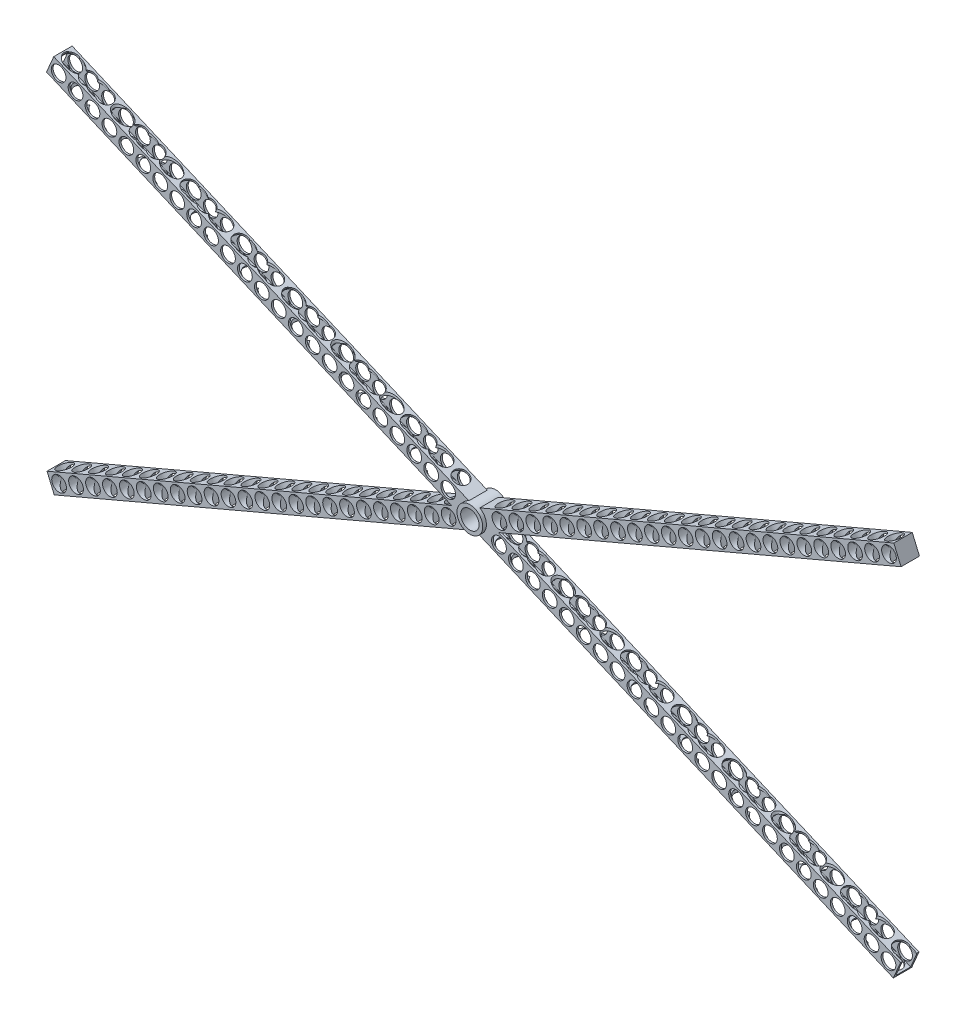
from build123d import *

# Parameters (mm, degrees)
SKIZZE1_R                        = 35
SKIZZE1_R_2                      = 25
AUFSATZ_LINEAR_AUSTRAGEN1_DEPTH  = 70
SKIZZE4_W                        = 50
SKIZZE4_H                        = 50
AUFSATZ_LINEAR_AUSTRAGEN3_DEPTH  = 1250
SKIZZE5_W                        = 40
SKIZZE5_H                        = 40
SCHNITT_LINEAR_AUSTRAGEN2_DEPTH  = 1250
SKIZZE7_R                        = 20
SCHNITT_LINEAR_AUSTRAGEN4_DEPTH  = 1270.580645038
LINEARES_MUSTER2_COUNT           = 24
LINEARES_MUSTER2_PITCH           = 50
SKIZZE9_R                        = 20
SCHNITT_LINEAR_AUSTRAGEN6_DEPTH  = 1271.679028403
LINEARES_MUSTER3_COUNT           = 24
LINEARES_MUSTER3_PITCH           = 50
SPIEGELN7_COPY_1_SKETCH_R        = 20
SPIEGELN7_COPY_1_DEPTH           = 1270.580645038
SPIEGELN7_COPY_2_SKETCH_R        = 20
SPIEGELN7_COPY_2_DEPTH           = 1270.580645038
SPIEGELN7_COPY_3_SKETCH_R        = 20
SPIEGELN7_COPY_3_DEPTH           = 1270.580645038
SPIEGELN7_COPY_4_SKETCH_R        = 20
SPIEGELN7_COPY_4_DEPTH           = 1270.580645038
SPIEGELN7_COPY_5_SKETCH_R        = 20
SPIEGELN7_COPY_5_DEPTH           = 1270.580645038
SPIEGELN7_COPY_6_SKETCH_R        = 20
SPIEGELN7_COPY_6_DEPTH           = 1270.580645038
SPIEGELN7_COPY_7_SKETCH_R        = 20
SPIEGELN7_COPY_7_DEPTH           = 1270.580645038
SPIEGELN7_COPY_8_SKETCH_R        = 20
SPIEGELN7_COPY_8_DEPTH           = 1270.580645038
SPIEGELN7_COPY_9_SKETCH_R        = 20
SPIEGELN7_COPY_9_DEPTH           = 1270.580645038
SPIEGELN7_COPY_10_SKETCH_R       = 20
SPIEGELN7_COPY_10_DEPTH          = 1270.580645038
SPIEGELN7_COPY_11_SKETCH_R       = 20
SPIEGELN7_COPY_11_DEPTH          = 1270.580645038
SPIEGELN7_COPY_12_SKETCH_R       = 20
SPIEGELN7_COPY_12_DEPTH          = 1270.580645038
SPIEGELN7_COPY_13_SKETCH_R       = 20
SPIEGELN7_COPY_13_DEPTH          = 1270.580645038
SPIEGELN7_COPY_14_SKETCH_R       = 20
SPIEGELN7_COPY_14_DEPTH          = 1270.580645038
SPIEGELN7_COPY_15_SKETCH_R       = 20
SPIEGELN7_COPY_15_DEPTH          = 1270.580645038
SPIEGELN7_COPY_16_SKETCH_R       = 20
SPIEGELN7_COPY_16_DEPTH          = 1270.580645038
SPIEGELN7_COPY_17_SKETCH_R       = 20
SPIEGELN7_COPY_17_DEPTH          = 1270.580645038
SPIEGELN7_COPY_18_SKETCH_R       = 20
SPIEGELN7_COPY_18_DEPTH          = 1270.580645038
SPIEGELN7_COPY_19_SKETCH_R       = 20
SPIEGELN7_COPY_19_DEPTH          = 1270.580645038
SPIEGELN7_COPY_20_SKETCH_R       = 20
SPIEGELN7_COPY_20_DEPTH          = 1270.580645038
SPIEGELN7_COPY_21_SKETCH_R       = 20
SPIEGELN7_COPY_21_DEPTH          = 1270.580645038
SPIEGELN7_COPY_22_SKETCH_R       = 20
SPIEGELN7_COPY_22_DEPTH          = 1270.580645038
SPIEGELN7_COPY_23_SKETCH_R       = 20
SPIEGELN7_COPY_23_DEPTH          = 1270.580645038
SPIEGELN7_COPY_24_SKETCH_R       = 20
SPIEGELN7_COPY_24_DEPTH          = 1271.679028403
SPIEGELN7_COPY_25_SKETCH_R       = 20
SPIEGELN7_COPY_25_DEPTH          = 1271.679028403
SPIEGELN7_COPY_26_SKETCH_R       = 20
SPIEGELN7_COPY_26_DEPTH          = 1271.679028403
SPIEGELN7_COPY_27_SKETCH_R       = 20
SPIEGELN7_COPY_27_DEPTH          = 1271.679028403
SPIEGELN7_COPY_28_SKETCH_R       = 20
SPIEGELN7_COPY_28_DEPTH          = 1271.679028403
SPIEGELN7_COPY_29_SKETCH_R       = 20
SPIEGELN7_COPY_29_DEPTH          = 1271.679028403
SPIEGELN7_COPY_30_SKETCH_R       = 20
SPIEGELN7_COPY_30_DEPTH          = 1271.679028403
SPIEGELN7_COPY_31_SKETCH_R       = 20
SPIEGELN7_COPY_31_DEPTH          = 1271.679028403
SPIEGELN7_COPY_32_SKETCH_R       = 20
SPIEGELN7_COPY_32_DEPTH          = 1271.679028403
SPIEGELN7_COPY_33_SKETCH_R       = 20
SPIEGELN7_COPY_33_DEPTH          = 1271.679028403
SPIEGELN7_COPY_34_SKETCH_R       = 20
SPIEGELN7_COPY_34_DEPTH          = 1271.679028403
SPIEGELN7_COPY_35_SKETCH_R       = 20
SPIEGELN7_COPY_35_DEPTH          = 1271.679028403
SPIEGELN7_COPY_36_SKETCH_R       = 20
SPIEGELN7_COPY_36_DEPTH          = 1271.679028403
SPIEGELN7_COPY_37_SKETCH_R       = 20
SPIEGELN7_COPY_37_DEPTH          = 1271.679028403
SPIEGELN7_COPY_38_SKETCH_R       = 20
SPIEGELN7_COPY_38_DEPTH          = 1271.679028403
SPIEGELN7_COPY_39_SKETCH_R       = 20
SPIEGELN7_COPY_39_DEPTH          = 1271.679028403
SPIEGELN7_COPY_40_SKETCH_R       = 20
SPIEGELN7_COPY_40_DEPTH          = 1271.679028403
SPIEGELN7_COPY_41_SKETCH_R       = 20
SPIEGELN7_COPY_41_DEPTH          = 1271.679028403
SPIEGELN7_COPY_42_SKETCH_R       = 20
SPIEGELN7_COPY_42_DEPTH          = 1271.679028403
SPIEGELN7_COPY_43_SKETCH_R       = 20
SPIEGELN7_COPY_43_DEPTH          = 1271.679028403
SPIEGELN7_COPY_44_SKETCH_R       = 20
SPIEGELN7_COPY_44_DEPTH          = 1271.679028403
SPIEGELN7_COPY_45_SKETCH_R       = 20
SPIEGELN7_COPY_45_DEPTH          = 1271.679028403
SPIEGELN7_COPY_46_SKETCH_R       = 20
SPIEGELN7_COPY_46_DEPTH          = 1271.679028403
SKIZZE11_W                       = 50
SKIZZE11_H                       = 50
AUFSATZ_LINEAR_AUSTRAGEN4_DEPTH  = 1250
SKIZZE12_R                       = 20
SCHNITT_LINEAR_AUSTRAGEN8_DEPTH  = 1271.824523178
LINEARES_MUSTER4_COUNT           = 24
LINEARES_MUSTER4_PITCH           = 50
SKIZZE13_R                       = 20
SCHNITT_LINEAR_AUSTRAGEN9_DEPTH  = 1288.130598022
LINEARES_MUSTER5_COUNT           = 24
LINEARES_MUSTER5_PITCH           = 50
SPIEGELN8_COPY_1_SKETCH_R        = 20
SPIEGELN8_COPY_1_DEPTH           = 1271.824523178
SPIEGELN8_COPY_2_SKETCH_R        = 20
SPIEGELN8_COPY_2_DEPTH           = 1271.824523178
SPIEGELN8_COPY_3_SKETCH_R        = 20
SPIEGELN8_COPY_3_DEPTH           = 1271.824523178
SPIEGELN8_COPY_4_SKETCH_R        = 20
SPIEGELN8_COPY_4_DEPTH           = 1271.824523178
SPIEGELN8_COPY_5_SKETCH_R        = 20
SPIEGELN8_COPY_5_DEPTH           = 1271.824523178
SPIEGELN8_COPY_6_SKETCH_R        = 20
SPIEGELN8_COPY_6_DEPTH           = 1271.824523178
SPIEGELN8_COPY_7_SKETCH_R        = 20
SPIEGELN8_COPY_7_DEPTH           = 1271.824523178
SPIEGELN8_COPY_8_SKETCH_R        = 20
SPIEGELN8_COPY_8_DEPTH           = 1271.824523178
SPIEGELN8_COPY_9_SKETCH_R        = 20
SPIEGELN8_COPY_9_DEPTH           = 1271.824523178
SPIEGELN8_COPY_10_SKETCH_R       = 20
SPIEGELN8_COPY_10_DEPTH          = 1271.824523178
SPIEGELN8_COPY_11_SKETCH_R       = 20
SPIEGELN8_COPY_11_DEPTH          = 1271.824523178
SPIEGELN8_COPY_12_SKETCH_R       = 20
SPIEGELN8_COPY_12_DEPTH          = 1271.824523178
SPIEGELN8_COPY_13_SKETCH_R       = 20
SPIEGELN8_COPY_13_DEPTH          = 1271.824523178
SPIEGELN8_COPY_14_SKETCH_R       = 20
SPIEGELN8_COPY_14_DEPTH          = 1271.824523178
SPIEGELN8_COPY_15_SKETCH_R       = 20
SPIEGELN8_COPY_15_DEPTH          = 1271.824523178
SPIEGELN8_COPY_16_SKETCH_R       = 20
SPIEGELN8_COPY_16_DEPTH          = 1271.824523178
SPIEGELN8_COPY_17_SKETCH_R       = 20
SPIEGELN8_COPY_17_DEPTH          = 1271.824523178
SPIEGELN8_COPY_18_SKETCH_R       = 20
SPIEGELN8_COPY_18_DEPTH          = 1271.824523178
SPIEGELN8_COPY_19_SKETCH_R       = 20
SPIEGELN8_COPY_19_DEPTH          = 1271.824523178
SPIEGELN8_COPY_20_SKETCH_R       = 20
SPIEGELN8_COPY_20_DEPTH          = 1271.824523178
SPIEGELN8_COPY_21_SKETCH_R       = 20
SPIEGELN8_COPY_21_DEPTH          = 1271.824523178
SPIEGELN8_COPY_22_SKETCH_R       = 20
SPIEGELN8_COPY_22_DEPTH          = 1271.824523178
SPIEGELN8_COPY_23_SKETCH_R       = 20
SPIEGELN8_COPY_23_DEPTH          = 1271.824523178
SPIEGELN8_COPY_24_SKETCH_R       = 20
SPIEGELN8_COPY_24_DEPTH          = 1288.130598022
SPIEGELN8_COPY_25_SKETCH_R       = 20
SPIEGELN8_COPY_25_DEPTH          = 1288.130598022
SPIEGELN8_COPY_26_SKETCH_R       = 20
SPIEGELN8_COPY_26_DEPTH          = 1288.130598022
SPIEGELN8_COPY_27_SKETCH_R       = 20
SPIEGELN8_COPY_27_DEPTH          = 1288.130598022
SPIEGELN8_COPY_28_SKETCH_R       = 20
SPIEGELN8_COPY_28_DEPTH          = 1288.130598022
SPIEGELN8_COPY_29_SKETCH_R       = 20
SPIEGELN8_COPY_29_DEPTH          = 1288.130598022
SPIEGELN8_COPY_30_SKETCH_R       = 20
SPIEGELN8_COPY_30_DEPTH          = 1288.130598022
SPIEGELN8_COPY_31_SKETCH_R       = 20
SPIEGELN8_COPY_31_DEPTH          = 1288.130598022
SPIEGELN8_COPY_32_SKETCH_R       = 20
SPIEGELN8_COPY_32_DEPTH          = 1288.130598022
SPIEGELN8_COPY_33_SKETCH_R       = 20
SPIEGELN8_COPY_33_DEPTH          = 1288.130598022
SPIEGELN8_COPY_34_SKETCH_R       = 20
SPIEGELN8_COPY_34_DEPTH          = 1288.130598022
SPIEGELN8_COPY_35_SKETCH_R       = 20
SPIEGELN8_COPY_35_DEPTH          = 1288.130598022
SPIEGELN8_COPY_36_SKETCH_R       = 20
SPIEGELN8_COPY_36_DEPTH          = 1288.130598022
SPIEGELN8_COPY_37_SKETCH_R       = 20
SPIEGELN8_COPY_37_DEPTH          = 1288.130598022
SPIEGELN8_COPY_38_SKETCH_R       = 20
SPIEGELN8_COPY_38_DEPTH          = 1288.130598022
SPIEGELN8_COPY_39_SKETCH_R       = 20
SPIEGELN8_COPY_39_DEPTH          = 1288.130598022
SPIEGELN8_COPY_40_SKETCH_R       = 20
SPIEGELN8_COPY_40_DEPTH          = 1288.130598022
SPIEGELN8_COPY_41_SKETCH_R       = 20
SPIEGELN8_COPY_41_DEPTH          = 1288.130598022
SPIEGELN8_COPY_42_SKETCH_R       = 20
SPIEGELN8_COPY_42_DEPTH          = 1288.130598022
SPIEGELN8_COPY_43_SKETCH_R       = 20
SPIEGELN8_COPY_43_DEPTH          = 1288.130598022
SPIEGELN8_COPY_44_SKETCH_R       = 20
SPIEGELN8_COPY_44_DEPTH          = 1288.130598022
SPIEGELN8_COPY_45_SKETCH_R       = 20
SPIEGELN8_COPY_45_DEPTH          = 1288.130598022
SPIEGELN8_COPY_46_SKETCH_R       = 20
SPIEGELN8_COPY_46_DEPTH          = 1288.130598022
SKIZZE14_R                       = 25
SCHNITT_LINEAR_AUSTRAGEN10_DEPTH = 1273.628530597


with BuildPart() as part:
    # Skizze1 → Aufsatz-Linear austragen1 (new body)
    with BuildSketch(Plane.XY):
        Circle(SKIZZE1_R)
        Circle(SKIZZE1_R_2, mode=Mode.SUBTRACT)
    extrude(amount=AUFSATZ_LINEAR_AUSTRAGEN1_DEPTH)

    # Skizze4 → Aufsatz-Linear austragen3 (add)
    with BuildSketch(Plane(origin=(0, 0, 0), x_dir=(0, 0, -1), z_dir=(-0.919821497321739, 0.39233711660355824, 0))):
        with Locations((-35, 0)):
            Rectangle(SKIZZE4_W, SKIZZE4_H)
    aufsatz_linear_austragen3 = extrude(amount=AUFSATZ_LINEAR_AUSTRAGEN3_DEPTH)

    # Skizze5 → Schnitt-Linear austragen2 (cut)
    with BuildSketch(Plane(origin=(-1149.776871652, 490.421395754, 0), x_dir=(0, 0, 1), z_dir=(-0.919821497321739, 0.3923371166035583, 0))):
        with Locations((35, 0)):
            Rectangle(SKIZZE5_W, SKIZZE5_H)
    schnitt_linear_austragen2 = extrude(amount=-SCHNITT_LINEAR_AUSTRAGEN2_DEPTH, mode=Mode.SUBTRACT)

    # Skizze7 → Schnitt-Linear austragen4 (cut, symmetric)
    with BuildSketch(Plane.XY.offset(60)):
        with Locations(Location((-1126.781334219, 480.612967839, 0), (0, 0, 66.9))):
            Circle(SKIZZE7_R)
    schnitt_linear_austragen4 = extrude(amount=SCHNITT_LINEAR_AUSTRAGEN4_DEPTH, both=True, mode=Mode.SUBTRACT)

    # Lineares Muster2: Schnitt-Linear austragen4 ×24
    with Locations(*[Vector(0.9198214973217392, -0.39233711660355797, 0) * (i * LINEARES_MUSTER2_PITCH) for i in range(1, LINEARES_MUSTER2_COUNT)]):
        add(schnitt_linear_austragen4, mode=Mode.SUBTRACT)

    # Skizze9 → Schnitt-Linear austragen6 (cut, symmetric)
    with BuildSketch(Plane(origin=(-9.808427915, -22.995537433, 0), x_dir=(0.919821497321739, -0.39233711660355847, 0), z_dir=(-0.3923371166035584, -0.9198214973217389, 0))):
        with Locations((-1225, 35)):
            Circle(SKIZZE9_R)
    schnitt_linear_austragen6 = extrude(amount=SCHNITT_LINEAR_AUSTRAGEN6_DEPTH, both=True, mode=Mode.SUBTRACT)

    # Lineares Muster3: Schnitt-Linear austragen6 ×24
    with Locations(*[Vector(0.919821497321739, -0.39233711660355847, 0) * (i * LINEARES_MUSTER3_PITCH) for i in range(1, LINEARES_MUSTER3_COUNT)]):
        add(schnitt_linear_austragen6, mode=Mode.SUBTRACT)

    # Spiegeln7: Aufsatz-Linear austragen3, Schnitt-Linear austragen2, Schnitt-Linear austragen4, Schnitt-Linear austragen6 across plane
    add(aufsatz_linear_austragen3.mirror(Plane(origin=(0, 0, 0), x_dir=(0, 0, 1), z_dir=(-0.919821497321739, 0.39233711660355824, 0))))
    add(schnitt_linear_austragen2.mirror(Plane(origin=(0, 0, 0), x_dir=(0, 0, 1), z_dir=(-0.919821497321739, 0.39233711660355824, 0))), mode=Mode.SUBTRACT)
    add(schnitt_linear_austragen4.mirror(Plane(origin=(0, 0, 0), x_dir=(0, 0, 1), z_dir=(-0.919821497321739, 0.39233711660355824, 0))), mode=Mode.SUBTRACT)
    add(schnitt_linear_austragen6.mirror(Plane(origin=(0, 0, 0), x_dir=(0, 0, 1), z_dir=(-0.919821497321739, 0.39233711660355824, 0))), mode=Mode.SUBTRACT)

    # Spiegeln7 copy 1 sketch → Spiegeln7 copy 1 (cut, symmetric)
    with BuildSketch(Plane(origin=(-45.991074866, 19.61685583, 60), x_dir=(-0.6921431738704118, 0.7217602280983573, 0), z_dir=(0, 0, 1))):
        with Locations((-1126.781334219, -480.612967839)):
            Circle(SPIEGELN7_COPY_1_SKETCH_R)
    extrude(amount=SPIEGELN7_COPY_1_DEPTH, both=True, mode=Mode.SUBTRACT)

    # Spiegeln7 copy 2 sketch → Spiegeln7 copy 2 (cut, symmetric)
    with BuildSketch(Plane(origin=(-91.982149732, 39.23371166, 60), x_dir=(-0.6921431738704118, 0.7217602280983573, 0), z_dir=(0, 0, 1))):
        with Locations((-1126.781334219, -480.612967839)):
            Circle(SPIEGELN7_COPY_2_SKETCH_R)
    extrude(amount=SPIEGELN7_COPY_2_DEPTH, both=True, mode=Mode.SUBTRACT)

    # Spiegeln7 copy 3 sketch → Spiegeln7 copy 3 (cut, symmetric)
    with BuildSketch(Plane(origin=(-137.973224598, 58.850567491, 60), x_dir=(-0.6921431738704118, 0.7217602280983573, 0), z_dir=(0, 0, 1))):
        with Locations((-1126.781334219, -480.612967839)):
            Circle(SPIEGELN7_COPY_3_SKETCH_R)
    extrude(amount=SPIEGELN7_COPY_3_DEPTH, both=True, mode=Mode.SUBTRACT)

    # Spiegeln7 copy 4 sketch → Spiegeln7 copy 4 (cut, symmetric)
    with BuildSketch(Plane(origin=(-183.964299464, 78.467423321, 60), x_dir=(-0.6921431738704118, 0.7217602280983573, 0), z_dir=(0, 0, 1))):
        with Locations((-1126.781334219, -480.612967839)):
            Circle(SPIEGELN7_COPY_4_SKETCH_R)
    extrude(amount=SPIEGELN7_COPY_4_DEPTH, both=True, mode=Mode.SUBTRACT)

    # Spiegeln7 copy 5 sketch → Spiegeln7 copy 5 (cut, symmetric)
    with BuildSketch(Plane(origin=(-229.95537433, 98.084279151, 60), x_dir=(-0.6921431738704118, 0.7217602280983573, 0), z_dir=(0, 0, 1))):
        with Locations((-1126.781334219, -480.612967839)):
            Circle(SPIEGELN7_COPY_5_SKETCH_R)
    extrude(amount=SPIEGELN7_COPY_5_DEPTH, both=True, mode=Mode.SUBTRACT)

    # Spiegeln7 copy 6 sketch → Spiegeln7 copy 6 (cut, symmetric)
    with BuildSketch(Plane(origin=(-275.946449197, 117.701134981, 60), x_dir=(-0.6921431738704118, 0.7217602280983573, 0), z_dir=(0, 0, 1))):
        with Locations((-1126.781334219, -480.612967839)):
            Circle(SPIEGELN7_COPY_6_SKETCH_R)
    extrude(amount=SPIEGELN7_COPY_6_DEPTH, both=True, mode=Mode.SUBTRACT)

    # Spiegeln7 copy 7 sketch → Spiegeln7 copy 7 (cut, symmetric)
    with BuildSketch(Plane(origin=(-321.937524063, 137.317990811, 60), x_dir=(-0.6921431738704118, 0.7217602280983573, 0), z_dir=(0, 0, 1))):
        with Locations((-1126.781334219, -480.612967839)):
            Circle(SPIEGELN7_COPY_7_SKETCH_R)
    extrude(amount=SPIEGELN7_COPY_7_DEPTH, both=True, mode=Mode.SUBTRACT)

    # Spiegeln7 copy 8 sketch → Spiegeln7 copy 8 (cut, symmetric)
    with BuildSketch(Plane(origin=(-367.928598929, 156.934846641, 60), x_dir=(-0.6921431738704118, 0.7217602280983573, 0), z_dir=(0, 0, 1))):
        with Locations((-1126.781334219, -480.612967839)):
            Circle(SPIEGELN7_COPY_8_SKETCH_R)
    extrude(amount=SPIEGELN7_COPY_8_DEPTH, both=True, mode=Mode.SUBTRACT)

    # Spiegeln7 copy 9 sketch → Spiegeln7 copy 9 (cut, symmetric)
    with BuildSketch(Plane(origin=(-413.919673795, 176.551702472, 60), x_dir=(-0.6921431738704118, 0.7217602280983573, 0), z_dir=(0, 0, 1))):
        with Locations((-1126.781334219, -480.612967839)):
            Circle(SPIEGELN7_COPY_9_SKETCH_R)
    extrude(amount=SPIEGELN7_COPY_9_DEPTH, both=True, mode=Mode.SUBTRACT)

    # Spiegeln7 copy 10 sketch → Spiegeln7 copy 10 (cut, symmetric)
    with BuildSketch(Plane(origin=(-459.910748661, 196.168558302, 60), x_dir=(-0.6921431738704118, 0.7217602280983573, 0), z_dir=(0, 0, 1))):
        with Locations((-1126.781334219, -480.612967839)):
            Circle(SPIEGELN7_COPY_10_SKETCH_R)
    extrude(amount=SPIEGELN7_COPY_10_DEPTH, both=True, mode=Mode.SUBTRACT)

    # Spiegeln7 copy 11 sketch → Spiegeln7 copy 11 (cut, symmetric)
    with BuildSketch(Plane(origin=(-505.901823527, 215.785414132, 60), x_dir=(-0.6921431738704118, 0.7217602280983573, 0), z_dir=(0, 0, 1))):
        with Locations((-1126.781334219, -480.612967839)):
            Circle(SPIEGELN7_COPY_11_SKETCH_R)
    extrude(amount=SPIEGELN7_COPY_11_DEPTH, both=True, mode=Mode.SUBTRACT)

    # Spiegeln7 copy 12 sketch → Spiegeln7 copy 12 (cut, symmetric)
    with BuildSketch(Plane(origin=(-551.892898393, 235.402269962, 60), x_dir=(-0.6921431738704118, 0.7217602280983573, 0), z_dir=(0, 0, 1))):
        with Locations((-1126.781334219, -480.612967839)):
            Circle(SPIEGELN7_COPY_12_SKETCH_R)
    extrude(amount=SPIEGELN7_COPY_12_DEPTH, both=True, mode=Mode.SUBTRACT)

    # Spiegeln7 copy 13 sketch → Spiegeln7 copy 13 (cut, symmetric)
    with BuildSketch(Plane(origin=(-597.883973259, 255.019125792, 60), x_dir=(-0.6921431738704118, 0.7217602280983573, 0), z_dir=(0, 0, 1))):
        with Locations((-1126.781334219, -480.612967839)):
            Circle(SPIEGELN7_COPY_13_SKETCH_R)
    extrude(amount=SPIEGELN7_COPY_13_DEPTH, both=True, mode=Mode.SUBTRACT)

    # Spiegeln7 copy 14 sketch → Spiegeln7 copy 14 (cut, symmetric)
    with BuildSketch(Plane(origin=(-643.875048125, 274.635981622, 60), x_dir=(-0.6921431738704118, 0.7217602280983573, 0), z_dir=(0, 0, 1))):
        with Locations((-1126.781334219, -480.612967839)):
            Circle(SPIEGELN7_COPY_14_SKETCH_R)
    extrude(amount=SPIEGELN7_COPY_14_DEPTH, both=True, mode=Mode.SUBTRACT)

    # Spiegeln7 copy 15 sketch → Spiegeln7 copy 15 (cut, symmetric)
    with BuildSketch(Plane(origin=(-689.866122991, 294.252837453, 60), x_dir=(-0.6921431738704118, 0.7217602280983573, 0), z_dir=(0, 0, 1))):
        with Locations((-1126.781334219, -480.612967839)):
            Circle(SPIEGELN7_COPY_15_SKETCH_R)
    extrude(amount=SPIEGELN7_COPY_15_DEPTH, both=True, mode=Mode.SUBTRACT)

    # Spiegeln7 copy 16 sketch → Spiegeln7 copy 16 (cut, symmetric)
    with BuildSketch(Plane(origin=(-735.857197857, 313.869693283, 60), x_dir=(-0.6921431738704118, 0.7217602280983573, 0), z_dir=(0, 0, 1))):
        with Locations((-1126.781334219, -480.612967839)):
            Circle(SPIEGELN7_COPY_16_SKETCH_R)
    extrude(amount=SPIEGELN7_COPY_16_DEPTH, both=True, mode=Mode.SUBTRACT)

    # Spiegeln7 copy 17 sketch → Spiegeln7 copy 17 (cut, symmetric)
    with BuildSketch(Plane(origin=(-781.848272723, 333.486549113, 60), x_dir=(-0.6921431738704118, 0.7217602280983573, 0), z_dir=(0, 0, 1))):
        with Locations((-1126.781334219, -480.612967839)):
            Circle(SPIEGELN7_COPY_17_SKETCH_R)
    extrude(amount=SPIEGELN7_COPY_17_DEPTH, both=True, mode=Mode.SUBTRACT)

    # Spiegeln7 copy 18 sketch → Spiegeln7 copy 18 (cut, symmetric)
    with BuildSketch(Plane(origin=(-827.83934759, 353.103404943, 60), x_dir=(-0.6921431738704118, 0.7217602280983573, 0), z_dir=(0, 0, 1))):
        with Locations((-1126.781334219, -480.612967839)):
            Circle(SPIEGELN7_COPY_18_SKETCH_R)
    extrude(amount=SPIEGELN7_COPY_18_DEPTH, both=True, mode=Mode.SUBTRACT)

    # Spiegeln7 copy 19 sketch → Spiegeln7 copy 19 (cut, symmetric)
    with BuildSketch(Plane(origin=(-873.830422456, 372.720260773, 60), x_dir=(-0.6921431738704118, 0.7217602280983573, 0), z_dir=(0, 0, 1))):
        with Locations((-1126.781334219, -480.612967839)):
            Circle(SPIEGELN7_COPY_19_SKETCH_R)
    extrude(amount=SPIEGELN7_COPY_19_DEPTH, both=True, mode=Mode.SUBTRACT)

    # Spiegeln7 copy 20 sketch → Spiegeln7 copy 20 (cut, symmetric)
    with BuildSketch(Plane(origin=(-919.821497322, 392.337116604, 60), x_dir=(-0.6921431738704118, 0.7217602280983573, 0), z_dir=(0, 0, 1))):
        with Locations((-1126.781334219, -480.612967839)):
            Circle(SPIEGELN7_COPY_20_SKETCH_R)
    extrude(amount=SPIEGELN7_COPY_20_DEPTH, both=True, mode=Mode.SUBTRACT)

    # Spiegeln7 copy 21 sketch → Spiegeln7 copy 21 (cut, symmetric)
    with BuildSketch(Plane(origin=(-965.812572188, 411.953972434, 60), x_dir=(-0.6921431738704118, 0.7217602280983573, 0), z_dir=(0, 0, 1))):
        with Locations((-1126.781334219, -480.612967839)):
            Circle(SPIEGELN7_COPY_21_SKETCH_R)
    extrude(amount=SPIEGELN7_COPY_21_DEPTH, both=True, mode=Mode.SUBTRACT)

    # Spiegeln7 copy 22 sketch → Spiegeln7 copy 22 (cut, symmetric)
    with BuildSketch(Plane(origin=(-1011.803647054, 431.570828264, 60), x_dir=(-0.6921431738704118, 0.7217602280983573, 0), z_dir=(0, 0, 1))):
        with Locations((-1126.781334219, -480.612967839)):
            Circle(SPIEGELN7_COPY_22_SKETCH_R)
    extrude(amount=SPIEGELN7_COPY_22_DEPTH, both=True, mode=Mode.SUBTRACT)

    # Spiegeln7 copy 23 sketch → Spiegeln7 copy 23 (cut, symmetric)
    with BuildSketch(Plane(origin=(-1057.79472192, 451.187684094, 60), x_dir=(-0.6921431738704118, 0.7217602280983573, 0), z_dir=(0, 0, 1))):
        with Locations((-1126.781334219, -480.612967839)):
            Circle(SPIEGELN7_COPY_23_SKETCH_R)
    extrude(amount=SPIEGELN7_COPY_23_DEPTH, both=True, mode=Mode.SUBTRACT)

    # Spiegeln7 copy 24 sketch → Spiegeln7 copy 24 (cut, symmetric)
    with BuildSketch(Plane(origin=(-55.799502781, -3.378681603, 0), x_dir=(-0.9198214973217391, 0.3923371166035581, 0), z_dir=(-0.392337116603558, -0.9198214973217391, 0))):
        with Locations((-1225, -35)):
            Circle(SPIEGELN7_COPY_24_SKETCH_R)
    extrude(amount=SPIEGELN7_COPY_24_DEPTH, both=True, mode=Mode.SUBTRACT)

    # Spiegeln7 copy 25 sketch → Spiegeln7 copy 25 (cut, symmetric)
    with BuildSketch(Plane(origin=(-101.790577647, 16.238174227, 0), x_dir=(-0.9198214973217391, 0.3923371166035581, 0), z_dir=(-0.392337116603558, -0.9198214973217391, 0))):
        with Locations((-1225, -35)):
            Circle(SPIEGELN7_COPY_25_SKETCH_R)
    extrude(amount=SPIEGELN7_COPY_25_DEPTH, both=True, mode=Mode.SUBTRACT)

    # Spiegeln7 copy 26 sketch → Spiegeln7 copy 26 (cut, symmetric)
    with BuildSketch(Plane(origin=(-147.781652513, 35.855030057, 0), x_dir=(-0.9198214973217391, 0.3923371166035581, 0), z_dir=(-0.392337116603558, -0.9198214973217391, 0))):
        with Locations((-1225, -35)):
            Circle(SPIEGELN7_COPY_26_SKETCH_R)
    extrude(amount=SPIEGELN7_COPY_26_DEPTH, both=True, mode=Mode.SUBTRACT)

    # Spiegeln7 copy 27 sketch → Spiegeln7 copy 27 (cut, symmetric)
    with BuildSketch(Plane(origin=(-193.772727379, 55.471885888, 0), x_dir=(-0.9198214973217391, 0.3923371166035581, 0), z_dir=(-0.392337116603558, -0.9198214973217391, 0))):
        with Locations((-1225, -35)):
            Circle(SPIEGELN7_COPY_27_SKETCH_R)
    extrude(amount=SPIEGELN7_COPY_27_DEPTH, both=True, mode=Mode.SUBTRACT)

    # Spiegeln7 copy 28 sketch → Spiegeln7 copy 28 (cut, symmetric)
    with BuildSketch(Plane(origin=(-239.763802246, 75.088741718, 0), x_dir=(-0.9198214973217391, 0.3923371166035581, 0), z_dir=(-0.392337116603558, -0.9198214973217391, 0))):
        with Locations((-1225, -35)):
            Circle(SPIEGELN7_COPY_28_SKETCH_R)
    extrude(amount=SPIEGELN7_COPY_28_DEPTH, both=True, mode=Mode.SUBTRACT)

    # Spiegeln7 copy 29 sketch → Spiegeln7 copy 29 (cut, symmetric)
    with BuildSketch(Plane(origin=(-285.754877112, 94.705597548, 0), x_dir=(-0.9198214973217391, 0.3923371166035581, 0), z_dir=(-0.392337116603558, -0.9198214973217391, 0))):
        with Locations((-1225, -35)):
            Circle(SPIEGELN7_COPY_29_SKETCH_R)
    extrude(amount=SPIEGELN7_COPY_29_DEPTH, both=True, mode=Mode.SUBTRACT)

    # Spiegeln7 copy 30 sketch → Spiegeln7 copy 30 (cut, symmetric)
    with BuildSketch(Plane(origin=(-331.745951978, 114.322453378, 0), x_dir=(-0.9198214973217391, 0.3923371166035581, 0), z_dir=(-0.392337116603558, -0.9198214973217391, 0))):
        with Locations((-1225, -35)):
            Circle(SPIEGELN7_COPY_30_SKETCH_R)
    extrude(amount=SPIEGELN7_COPY_30_DEPTH, both=True, mode=Mode.SUBTRACT)

    # Spiegeln7 copy 31 sketch → Spiegeln7 copy 31 (cut, symmetric)
    with BuildSketch(Plane(origin=(-377.737026844, 133.939309208, 0), x_dir=(-0.9198214973217391, 0.3923371166035581, 0), z_dir=(-0.392337116603558, -0.9198214973217391, 0))):
        with Locations((-1225, -35)):
            Circle(SPIEGELN7_COPY_31_SKETCH_R)
    extrude(amount=SPIEGELN7_COPY_31_DEPTH, both=True, mode=Mode.SUBTRACT)

    # Spiegeln7 copy 32 sketch → Spiegeln7 copy 32 (cut, symmetric)
    with BuildSketch(Plane(origin=(-423.72810171, 153.556165039, 0), x_dir=(-0.9198214973217391, 0.3923371166035581, 0), z_dir=(-0.392337116603558, -0.9198214973217391, 0))):
        with Locations((-1225, -35)):
            Circle(SPIEGELN7_COPY_32_SKETCH_R)
    extrude(amount=SPIEGELN7_COPY_32_DEPTH, both=True, mode=Mode.SUBTRACT)

    # Spiegeln7 copy 33 sketch → Spiegeln7 copy 33 (cut, symmetric)
    with BuildSketch(Plane(origin=(-469.719176576, 173.173020869, 0), x_dir=(-0.9198214973217391, 0.3923371166035581, 0), z_dir=(-0.392337116603558, -0.9198214973217391, 0))):
        with Locations((-1225, -35)):
            Circle(SPIEGELN7_COPY_33_SKETCH_R)
    extrude(amount=SPIEGELN7_COPY_33_DEPTH, both=True, mode=Mode.SUBTRACT)

    # Spiegeln7 copy 34 sketch → Spiegeln7 copy 34 (cut, symmetric)
    with BuildSketch(Plane(origin=(-515.710251442, 192.789876699, 0), x_dir=(-0.9198214973217391, 0.3923371166035581, 0), z_dir=(-0.392337116603558, -0.9198214973217391, 0))):
        with Locations((-1225, -35)):
            Circle(SPIEGELN7_COPY_34_SKETCH_R)
    extrude(amount=SPIEGELN7_COPY_34_DEPTH, both=True, mode=Mode.SUBTRACT)

    # Spiegeln7 copy 35 sketch → Spiegeln7 copy 35 (cut, symmetric)
    with BuildSketch(Plane(origin=(-561.701326308, 212.406732529, 0), x_dir=(-0.9198214973217391, 0.3923371166035581, 0), z_dir=(-0.392337116603558, -0.9198214973217391, 0))):
        with Locations((-1225, -35)):
            Circle(SPIEGELN7_COPY_35_SKETCH_R)
    extrude(amount=SPIEGELN7_COPY_35_DEPTH, both=True, mode=Mode.SUBTRACT)

    # Spiegeln7 copy 36 sketch → Spiegeln7 copy 36 (cut, symmetric)
    with BuildSketch(Plane(origin=(-607.692401174, 232.023588359, 0), x_dir=(-0.9198214973217391, 0.3923371166035581, 0), z_dir=(-0.392337116603558, -0.9198214973217391, 0))):
        with Locations((-1225, -35)):
            Circle(SPIEGELN7_COPY_36_SKETCH_R)
    extrude(amount=SPIEGELN7_COPY_36_DEPTH, both=True, mode=Mode.SUBTRACT)

    # Spiegeln7 copy 37 sketch → Spiegeln7 copy 37 (cut, symmetric)
    with BuildSketch(Plane(origin=(-653.68347604, 251.640444189, 0), x_dir=(-0.9198214973217391, 0.3923371166035581, 0), z_dir=(-0.392337116603558, -0.9198214973217391, 0))):
        with Locations((-1225, -35)):
            Circle(SPIEGELN7_COPY_37_SKETCH_R)
    extrude(amount=SPIEGELN7_COPY_37_DEPTH, both=True, mode=Mode.SUBTRACT)

    # Spiegeln7 copy 38 sketch → Spiegeln7 copy 38 (cut, symmetric)
    with BuildSketch(Plane(origin=(-699.674550906, 271.25730002, 0), x_dir=(-0.9198214973217391, 0.3923371166035581, 0), z_dir=(-0.392337116603558, -0.9198214973217391, 0))):
        with Locations((-1225, -35)):
            Circle(SPIEGELN7_COPY_38_SKETCH_R)
    extrude(amount=SPIEGELN7_COPY_38_DEPTH, both=True, mode=Mode.SUBTRACT)

    # Spiegeln7 copy 39 sketch → Spiegeln7 copy 39 (cut, symmetric)
    with BuildSketch(Plane(origin=(-745.665625772, 290.87415585, 0), x_dir=(-0.9198214973217391, 0.3923371166035581, 0), z_dir=(-0.392337116603558, -0.9198214973217391, 0))):
        with Locations((-1225, -35)):
            Circle(SPIEGELN7_COPY_39_SKETCH_R)
    extrude(amount=SPIEGELN7_COPY_39_DEPTH, both=True, mode=Mode.SUBTRACT)

    # Spiegeln7 copy 40 sketch → Spiegeln7 copy 40 (cut, symmetric)
    with BuildSketch(Plane(origin=(-791.656700639, 310.49101168, 0), x_dir=(-0.9198214973217391, 0.3923371166035581, 0), z_dir=(-0.392337116603558, -0.9198214973217391, 0))):
        with Locations((-1225, -35)):
            Circle(SPIEGELN7_COPY_40_SKETCH_R)
    extrude(amount=SPIEGELN7_COPY_40_DEPTH, both=True, mode=Mode.SUBTRACT)

    # Spiegeln7 copy 41 sketch → Spiegeln7 copy 41 (cut, symmetric)
    with BuildSketch(Plane(origin=(-837.647775505, 330.10786751, 0), x_dir=(-0.9198214973217391, 0.3923371166035581, 0), z_dir=(-0.392337116603558, -0.9198214973217391, 0))):
        with Locations((-1225, -35)):
            Circle(SPIEGELN7_COPY_41_SKETCH_R)
    extrude(amount=SPIEGELN7_COPY_41_DEPTH, both=True, mode=Mode.SUBTRACT)

    # Spiegeln7 copy 42 sketch → Spiegeln7 copy 42 (cut, symmetric)
    with BuildSketch(Plane(origin=(-883.638850371, 349.72472334, 0), x_dir=(-0.9198214973217391, 0.3923371166035581, 0), z_dir=(-0.392337116603558, -0.9198214973217391, 0))):
        with Locations((-1225, -35)):
            Circle(SPIEGELN7_COPY_42_SKETCH_R)
    extrude(amount=SPIEGELN7_COPY_42_DEPTH, both=True, mode=Mode.SUBTRACT)

    # Spiegeln7 copy 43 sketch → Spiegeln7 copy 43 (cut, symmetric)
    with BuildSketch(Plane(origin=(-929.629925237, 369.341579171, 0), x_dir=(-0.9198214973217391, 0.3923371166035581, 0), z_dir=(-0.392337116603558, -0.9198214973217391, 0))):
        with Locations((-1225, -35)):
            Circle(SPIEGELN7_COPY_43_SKETCH_R)
    extrude(amount=SPIEGELN7_COPY_43_DEPTH, both=True, mode=Mode.SUBTRACT)

    # Spiegeln7 copy 44 sketch → Spiegeln7 copy 44 (cut, symmetric)
    with BuildSketch(Plane(origin=(-975.621000103, 388.958435001, 0), x_dir=(-0.9198214973217391, 0.3923371166035581, 0), z_dir=(-0.392337116603558, -0.9198214973217391, 0))):
        with Locations((-1225, -35)):
            Circle(SPIEGELN7_COPY_44_SKETCH_R)
    extrude(amount=SPIEGELN7_COPY_44_DEPTH, both=True, mode=Mode.SUBTRACT)

    # Spiegeln7 copy 45 sketch → Spiegeln7 copy 45 (cut, symmetric)
    with BuildSketch(Plane(origin=(-1021.612074969, 408.575290831, 0), x_dir=(-0.9198214973217391, 0.3923371166035581, 0), z_dir=(-0.392337116603558, -0.9198214973217391, 0))):
        with Locations((-1225, -35)):
            Circle(SPIEGELN7_COPY_45_SKETCH_R)
    extrude(amount=SPIEGELN7_COPY_45_DEPTH, both=True, mode=Mode.SUBTRACT)

    # Spiegeln7 copy 46 sketch → Spiegeln7 copy 46 (cut, symmetric)
    with BuildSketch(Plane(origin=(-1067.603149835, 428.192146661, 0), x_dir=(-0.9198214973217391, 0.3923371166035581, 0), z_dir=(-0.392337116603558, -0.9198214973217391, 0))):
        with Locations((-1225, -35)):
            Circle(SPIEGELN7_COPY_46_SKETCH_R)
    extrude(amount=SPIEGELN7_COPY_46_DEPTH, both=True, mode=Mode.SUBTRACT)

    # Skizze11 → Aufsatz-Linear austragen4 (add)
    with BuildSketch(Plane(origin=(0, 0, 0), x_dir=(0, 0, -1), z_dir=(0.9198214973217387, 0.3923371166035591, 0))):
        with Locations((-35, -3.470833675)):
            Rectangle(SKIZZE11_W, SKIZZE11_H)
    aufsatz_linear_austragen4 = extrude(amount=AUFSATZ_LINEAR_AUSTRAGEN4_DEPTH)

    # Skizze12 → Schnitt-Linear austragen8 (cut, symmetric)
    with BuildSketch(Plane.XY.offset(60)):
        with Locations((1128.115836358, 477.48427136)):
            Circle(SKIZZE12_R)
    schnitt_linear_austragen8 = extrude(amount=SCHNITT_LINEAR_AUSTRAGEN8_DEPTH, both=True, mode=Mode.SUBTRACT)

    # Lineares Muster4: Schnitt-Linear austragen8 ×24
    with Locations(*[Vector(-0.9198214973217388, -0.3923371166035589, 0) * (i * LINEARES_MUSTER4_PITCH) for i in range(1, LINEARES_MUSTER4_COUNT)]):
        add(schnitt_linear_austragen8, mode=Mode.SUBTRACT)

    # Skizze13 → Schnitt-Linear austragen9 (cut, symmetric)
    with BuildSketch(Plane(origin=(-8.446691039, 19.802990005, 0), x_dir=(0.9198214973217387, 0.3923371166035592, 0), z_dir=(-0.3923371166035592, 0.9198214973217387, 0))):
        with Locations((1225, -35)):
            Circle(SKIZZE13_R)
    schnitt_linear_austragen9 = extrude(amount=SCHNITT_LINEAR_AUSTRAGEN9_DEPTH, both=True, mode=Mode.SUBTRACT)

    # Lineares Muster5: Schnitt-Linear austragen9 ×24
    with Locations(*[Vector(-0.9198214973217387, -0.39233711660355913, 0) * (i * LINEARES_MUSTER5_PITCH) for i in range(1, LINEARES_MUSTER5_COUNT)]):
        add(schnitt_linear_austragen9, mode=Mode.SUBTRACT)

    # Spiegeln8: Aufsatz-Linear austragen4, Schnitt-Linear austragen8, Schnitt-Linear austragen9 across plane
    add(aufsatz_linear_austragen4.mirror(Plane(origin=(0, 0, 0), x_dir=(0, 0, 1), z_dir=(0.9198214973217387, 0.3923371166035591, 0))))
    add(schnitt_linear_austragen8.mirror(Plane(origin=(0, 0, 0), x_dir=(0, 0, 1), z_dir=(0.9198214973217387, 0.3923371166035591, 0))), mode=Mode.SUBTRACT)
    add(schnitt_linear_austragen9.mirror(Plane(origin=(0, 0, 0), x_dir=(0, 0, 1), z_dir=(0.9198214973217387, 0.3923371166035591, 0))), mode=Mode.SUBTRACT)

    # Spiegeln8 copy 1 sketch → Spiegeln8 copy 1 (cut, symmetric)
    with BuildSketch(Plane(origin=(45.991074866, 19.61685583, 60), x_dir=(-0.6921431738704107, -0.7217602280983586, 0), z_dir=(0, 0, 1))):
        with Locations((1128.115836358, -477.48427136)):
            Circle(SPIEGELN8_COPY_1_SKETCH_R)
    extrude(amount=SPIEGELN8_COPY_1_DEPTH, both=True, mode=Mode.SUBTRACT)

    # Spiegeln8 copy 2 sketch → Spiegeln8 copy 2 (cut, symmetric)
    with BuildSketch(Plane(origin=(91.982149732, 39.23371166, 60), x_dir=(-0.6921431738704107, -0.7217602280983586, 0), z_dir=(0, 0, 1))):
        with Locations((1128.115836358, -477.48427136)):
            Circle(SPIEGELN8_COPY_2_SKETCH_R)
    extrude(amount=SPIEGELN8_COPY_2_DEPTH, both=True, mode=Mode.SUBTRACT)

    # Spiegeln8 copy 3 sketch → Spiegeln8 copy 3 (cut, symmetric)
    with BuildSketch(Plane(origin=(137.973224598, 58.850567491, 60), x_dir=(-0.6921431738704107, -0.7217602280983586, 0), z_dir=(0, 0, 1))):
        with Locations((1128.115836358, -477.48427136)):
            Circle(SPIEGELN8_COPY_3_SKETCH_R)
    extrude(amount=SPIEGELN8_COPY_3_DEPTH, both=True, mode=Mode.SUBTRACT)

    # Spiegeln8 copy 4 sketch → Spiegeln8 copy 4 (cut, symmetric)
    with BuildSketch(Plane(origin=(183.964299464, 78.467423321, 60), x_dir=(-0.6921431738704107, -0.7217602280983586, 0), z_dir=(0, 0, 1))):
        with Locations((1128.115836358, -477.48427136)):
            Circle(SPIEGELN8_COPY_4_SKETCH_R)
    extrude(amount=SPIEGELN8_COPY_4_DEPTH, both=True, mode=Mode.SUBTRACT)

    # Spiegeln8 copy 5 sketch → Spiegeln8 copy 5 (cut, symmetric)
    with BuildSketch(Plane(origin=(229.95537433, 98.084279151, 60), x_dir=(-0.6921431738704107, -0.7217602280983586, 0), z_dir=(0, 0, 1))):
        with Locations((1128.115836358, -477.48427136)):
            Circle(SPIEGELN8_COPY_5_SKETCH_R)
    extrude(amount=SPIEGELN8_COPY_5_DEPTH, both=True, mode=Mode.SUBTRACT)

    # Spiegeln8 copy 6 sketch → Spiegeln8 copy 6 (cut, symmetric)
    with BuildSketch(Plane(origin=(275.946449197, 117.701134981, 60), x_dir=(-0.6921431738704107, -0.7217602280983586, 0), z_dir=(0, 0, 1))):
        with Locations((1128.115836358, -477.48427136)):
            Circle(SPIEGELN8_COPY_6_SKETCH_R)
    extrude(amount=SPIEGELN8_COPY_6_DEPTH, both=True, mode=Mode.SUBTRACT)

    # Spiegeln8 copy 7 sketch → Spiegeln8 copy 7 (cut, symmetric)
    with BuildSketch(Plane(origin=(321.937524063, 137.317990811, 60), x_dir=(-0.6921431738704107, -0.7217602280983586, 0), z_dir=(0, 0, 1))):
        with Locations((1128.115836358, -477.48427136)):
            Circle(SPIEGELN8_COPY_7_SKETCH_R)
    extrude(amount=SPIEGELN8_COPY_7_DEPTH, both=True, mode=Mode.SUBTRACT)

    # Spiegeln8 copy 8 sketch → Spiegeln8 copy 8 (cut, symmetric)
    with BuildSketch(Plane(origin=(367.928598929, 156.934846641, 60), x_dir=(-0.6921431738704107, -0.7217602280983586, 0), z_dir=(0, 0, 1))):
        with Locations((1128.115836358, -477.48427136)):
            Circle(SPIEGELN8_COPY_8_SKETCH_R)
    extrude(amount=SPIEGELN8_COPY_8_DEPTH, both=True, mode=Mode.SUBTRACT)

    # Spiegeln8 copy 9 sketch → Spiegeln8 copy 9 (cut, symmetric)
    with BuildSketch(Plane(origin=(413.919673795, 176.551702472, 60), x_dir=(-0.6921431738704107, -0.7217602280983586, 0), z_dir=(0, 0, 1))):
        with Locations((1128.115836358, -477.48427136)):
            Circle(SPIEGELN8_COPY_9_SKETCH_R)
    extrude(amount=SPIEGELN8_COPY_9_DEPTH, both=True, mode=Mode.SUBTRACT)

    # Spiegeln8 copy 10 sketch → Spiegeln8 copy 10 (cut, symmetric)
    with BuildSketch(Plane(origin=(459.910748661, 196.168558302, 60), x_dir=(-0.6921431738704107, -0.7217602280983586, 0), z_dir=(0, 0, 1))):
        with Locations((1128.115836358, -477.48427136)):
            Circle(SPIEGELN8_COPY_10_SKETCH_R)
    extrude(amount=SPIEGELN8_COPY_10_DEPTH, both=True, mode=Mode.SUBTRACT)

    # Spiegeln8 copy 11 sketch → Spiegeln8 copy 11 (cut, symmetric)
    with BuildSketch(Plane(origin=(505.901823527, 215.785414132, 60), x_dir=(-0.6921431738704107, -0.7217602280983586, 0), z_dir=(0, 0, 1))):
        with Locations((1128.115836358, -477.48427136)):
            Circle(SPIEGELN8_COPY_11_SKETCH_R)
    extrude(amount=SPIEGELN8_COPY_11_DEPTH, both=True, mode=Mode.SUBTRACT)

    # Spiegeln8 copy 12 sketch → Spiegeln8 copy 12 (cut, symmetric)
    with BuildSketch(Plane(origin=(551.892898393, 235.402269962, 60), x_dir=(-0.6921431738704107, -0.7217602280983586, 0), z_dir=(0, 0, 1))):
        with Locations((1128.115836358, -477.48427136)):
            Circle(SPIEGELN8_COPY_12_SKETCH_R)
    extrude(amount=SPIEGELN8_COPY_12_DEPTH, both=True, mode=Mode.SUBTRACT)

    # Spiegeln8 copy 13 sketch → Spiegeln8 copy 13 (cut, symmetric)
    with BuildSketch(Plane(origin=(597.883973259, 255.019125792, 60), x_dir=(-0.6921431738704107, -0.7217602280983586, 0), z_dir=(0, 0, 1))):
        with Locations((1128.115836358, -477.48427136)):
            Circle(SPIEGELN8_COPY_13_SKETCH_R)
    extrude(amount=SPIEGELN8_COPY_13_DEPTH, both=True, mode=Mode.SUBTRACT)

    # Spiegeln8 copy 14 sketch → Spiegeln8 copy 14 (cut, symmetric)
    with BuildSketch(Plane(origin=(643.875048125, 274.635981622, 60), x_dir=(-0.6921431738704107, -0.7217602280983586, 0), z_dir=(0, 0, 1))):
        with Locations((1128.115836358, -477.48427136)):
            Circle(SPIEGELN8_COPY_14_SKETCH_R)
    extrude(amount=SPIEGELN8_COPY_14_DEPTH, both=True, mode=Mode.SUBTRACT)

    # Spiegeln8 copy 15 sketch → Spiegeln8 copy 15 (cut, symmetric)
    with BuildSketch(Plane(origin=(689.866122991, 294.252837453, 60), x_dir=(-0.6921431738704107, -0.7217602280983586, 0), z_dir=(0, 0, 1))):
        with Locations((1128.115836358, -477.48427136)):
            Circle(SPIEGELN8_COPY_15_SKETCH_R)
    extrude(amount=SPIEGELN8_COPY_15_DEPTH, both=True, mode=Mode.SUBTRACT)

    # Spiegeln8 copy 16 sketch → Spiegeln8 copy 16 (cut, symmetric)
    with BuildSketch(Plane(origin=(735.857197857, 313.869693283, 60), x_dir=(-0.6921431738704107, -0.7217602280983586, 0), z_dir=(0, 0, 1))):
        with Locations((1128.115836358, -477.48427136)):
            Circle(SPIEGELN8_COPY_16_SKETCH_R)
    extrude(amount=SPIEGELN8_COPY_16_DEPTH, both=True, mode=Mode.SUBTRACT)

    # Spiegeln8 copy 17 sketch → Spiegeln8 copy 17 (cut, symmetric)
    with BuildSketch(Plane(origin=(781.848272723, 333.486549113, 60), x_dir=(-0.6921431738704107, -0.7217602280983586, 0), z_dir=(0, 0, 1))):
        with Locations((1128.115836358, -477.48427136)):
            Circle(SPIEGELN8_COPY_17_SKETCH_R)
    extrude(amount=SPIEGELN8_COPY_17_DEPTH, both=True, mode=Mode.SUBTRACT)

    # Spiegeln8 copy 18 sketch → Spiegeln8 copy 18 (cut, symmetric)
    with BuildSketch(Plane(origin=(827.83934759, 353.103404943, 60), x_dir=(-0.6921431738704107, -0.7217602280983586, 0), z_dir=(0, 0, 1))):
        with Locations((1128.115836358, -477.48427136)):
            Circle(SPIEGELN8_COPY_18_SKETCH_R)
    extrude(amount=SPIEGELN8_COPY_18_DEPTH, both=True, mode=Mode.SUBTRACT)

    # Spiegeln8 copy 19 sketch → Spiegeln8 copy 19 (cut, symmetric)
    with BuildSketch(Plane(origin=(873.830422456, 372.720260773, 60), x_dir=(-0.6921431738704107, -0.7217602280983586, 0), z_dir=(0, 0, 1))):
        with Locations((1128.115836358, -477.48427136)):
            Circle(SPIEGELN8_COPY_19_SKETCH_R)
    extrude(amount=SPIEGELN8_COPY_19_DEPTH, both=True, mode=Mode.SUBTRACT)

    # Spiegeln8 copy 20 sketch → Spiegeln8 copy 20 (cut, symmetric)
    with BuildSketch(Plane(origin=(919.821497322, 392.337116604, 60), x_dir=(-0.6921431738704107, -0.7217602280983586, 0), z_dir=(0, 0, 1))):
        with Locations((1128.115836358, -477.48427136)):
            Circle(SPIEGELN8_COPY_20_SKETCH_R)
    extrude(amount=SPIEGELN8_COPY_20_DEPTH, both=True, mode=Mode.SUBTRACT)

    # Spiegeln8 copy 21 sketch → Spiegeln8 copy 21 (cut, symmetric)
    with BuildSketch(Plane(origin=(965.812572188, 411.953972434, 60), x_dir=(-0.6921431738704107, -0.7217602280983586, 0), z_dir=(0, 0, 1))):
        with Locations((1128.115836358, -477.48427136)):
            Circle(SPIEGELN8_COPY_21_SKETCH_R)
    extrude(amount=SPIEGELN8_COPY_21_DEPTH, both=True, mode=Mode.SUBTRACT)

    # Spiegeln8 copy 22 sketch → Spiegeln8 copy 22 (cut, symmetric)
    with BuildSketch(Plane(origin=(1011.803647054, 431.570828264, 60), x_dir=(-0.6921431738704107, -0.7217602280983586, 0), z_dir=(0, 0, 1))):
        with Locations((1128.115836358, -477.48427136)):
            Circle(SPIEGELN8_COPY_22_SKETCH_R)
    extrude(amount=SPIEGELN8_COPY_22_DEPTH, both=True, mode=Mode.SUBTRACT)

    # Spiegeln8 copy 23 sketch → Spiegeln8 copy 23 (cut, symmetric)
    with BuildSketch(Plane(origin=(1057.79472192, 451.187684094, 60), x_dir=(-0.6921431738704107, -0.7217602280983586, 0), z_dir=(0, 0, 1))):
        with Locations((1128.115836358, -477.48427136)):
            Circle(SPIEGELN8_COPY_23_SKETCH_R)
    extrude(amount=SPIEGELN8_COPY_23_DEPTH, both=True, mode=Mode.SUBTRACT)

    # Spiegeln8 copy 24 sketch → Spiegeln8 copy 24 (cut, symmetric)
    with BuildSketch(Plane(origin=(37.544383827, 39.419845835, 0), x_dir=(-0.9198214973217389, -0.3923371166035591, 0), z_dir=(-0.392337116603559, 0.9198214973217388, 0))):
        with Locations((1225, 35)):
            Circle(SPIEGELN8_COPY_24_SKETCH_R)
    extrude(amount=SPIEGELN8_COPY_24_DEPTH, both=True, mode=Mode.SUBTRACT)

    # Spiegeln8 copy 25 sketch → Spiegeln8 copy 25 (cut, symmetric)
    with BuildSketch(Plane(origin=(83.535458694, 59.036701665, 0), x_dir=(-0.9198214973217389, -0.3923371166035591, 0), z_dir=(-0.392337116603559, 0.9198214973217388, 0))):
        with Locations((1225, 35)):
            Circle(SPIEGELN8_COPY_25_SKETCH_R)
    extrude(amount=SPIEGELN8_COPY_25_DEPTH, both=True, mode=Mode.SUBTRACT)

    # Spiegeln8 copy 26 sketch → Spiegeln8 copy 26 (cut, symmetric)
    with BuildSketch(Plane(origin=(129.52653356, 78.653557495, 0), x_dir=(-0.9198214973217389, -0.3923371166035591, 0), z_dir=(-0.392337116603559, 0.9198214973217388, 0))):
        with Locations((1225, 35)):
            Circle(SPIEGELN8_COPY_26_SKETCH_R)
    extrude(amount=SPIEGELN8_COPY_26_DEPTH, both=True, mode=Mode.SUBTRACT)

    # Spiegeln8 copy 27 sketch → Spiegeln8 copy 27 (cut, symmetric)
    with BuildSketch(Plane(origin=(175.517608426, 98.270413325, 0), x_dir=(-0.9198214973217389, -0.3923371166035591, 0), z_dir=(-0.392337116603559, 0.9198214973217388, 0))):
        with Locations((1225, 35)):
            Circle(SPIEGELN8_COPY_27_SKETCH_R)
    extrude(amount=SPIEGELN8_COPY_27_DEPTH, both=True, mode=Mode.SUBTRACT)

    # Spiegeln8 copy 28 sketch → Spiegeln8 copy 28 (cut, symmetric)
    with BuildSketch(Plane(origin=(221.508683292, 117.887269156, 0), x_dir=(-0.9198214973217389, -0.3923371166035591, 0), z_dir=(-0.392337116603559, 0.9198214973217388, 0))):
        with Locations((1225, 35)):
            Circle(SPIEGELN8_COPY_28_SKETCH_R)
    extrude(amount=SPIEGELN8_COPY_28_DEPTH, both=True, mode=Mode.SUBTRACT)

    # Spiegeln8 copy 29 sketch → Spiegeln8 copy 29 (cut, symmetric)
    with BuildSketch(Plane(origin=(267.499758158, 137.504124986, 0), x_dir=(-0.9198214973217389, -0.3923371166035591, 0), z_dir=(-0.392337116603559, 0.9198214973217388, 0))):
        with Locations((1225, 35)):
            Circle(SPIEGELN8_COPY_29_SKETCH_R)
    extrude(amount=SPIEGELN8_COPY_29_DEPTH, both=True, mode=Mode.SUBTRACT)

    # Spiegeln8 copy 30 sketch → Spiegeln8 copy 30 (cut, symmetric)
    with BuildSketch(Plane(origin=(313.490833024, 157.120980816, 0), x_dir=(-0.9198214973217389, -0.3923371166035591, 0), z_dir=(-0.392337116603559, 0.9198214973217388, 0))):
        with Locations((1225, 35)):
            Circle(SPIEGELN8_COPY_30_SKETCH_R)
    extrude(amount=SPIEGELN8_COPY_30_DEPTH, both=True, mode=Mode.SUBTRACT)

    # Spiegeln8 copy 31 sketch → Spiegeln8 copy 31 (cut, symmetric)
    with BuildSketch(Plane(origin=(359.48190789, 176.737836646, 0), x_dir=(-0.9198214973217389, -0.3923371166035591, 0), z_dir=(-0.392337116603559, 0.9198214973217388, 0))):
        with Locations((1225, 35)):
            Circle(SPIEGELN8_COPY_31_SKETCH_R)
    extrude(amount=SPIEGELN8_COPY_31_DEPTH, both=True, mode=Mode.SUBTRACT)

    # Spiegeln8 copy 32 sketch → Spiegeln8 copy 32 (cut, symmetric)
    with BuildSketch(Plane(origin=(405.472982756, 196.354692476, 0), x_dir=(-0.9198214973217389, -0.3923371166035591, 0), z_dir=(-0.392337116603559, 0.9198214973217388, 0))):
        with Locations((1225, 35)):
            Circle(SPIEGELN8_COPY_32_SKETCH_R)
    extrude(amount=SPIEGELN8_COPY_32_DEPTH, both=True, mode=Mode.SUBTRACT)

    # Spiegeln8 copy 33 sketch → Spiegeln8 copy 33 (cut, symmetric)
    with BuildSketch(Plane(origin=(451.464057622, 215.971548307, 0), x_dir=(-0.9198214973217389, -0.3923371166035591, 0), z_dir=(-0.392337116603559, 0.9198214973217388, 0))):
        with Locations((1225, 35)):
            Circle(SPIEGELN8_COPY_33_SKETCH_R)
    extrude(amount=SPIEGELN8_COPY_33_DEPTH, both=True, mode=Mode.SUBTRACT)

    # Spiegeln8 copy 34 sketch → Spiegeln8 copy 34 (cut, symmetric)
    with BuildSketch(Plane(origin=(497.455132488, 235.588404137, 0), x_dir=(-0.9198214973217389, -0.3923371166035591, 0), z_dir=(-0.392337116603559, 0.9198214973217388, 0))):
        with Locations((1225, 35)):
            Circle(SPIEGELN8_COPY_34_SKETCH_R)
    extrude(amount=SPIEGELN8_COPY_34_DEPTH, both=True, mode=Mode.SUBTRACT)

    # Spiegeln8 copy 35 sketch → Spiegeln8 copy 35 (cut, symmetric)
    with BuildSketch(Plane(origin=(543.446207354, 255.205259967, 0), x_dir=(-0.9198214973217389, -0.3923371166035591, 0), z_dir=(-0.392337116603559, 0.9198214973217388, 0))):
        with Locations((1225, 35)):
            Circle(SPIEGELN8_COPY_35_SKETCH_R)
    extrude(amount=SPIEGELN8_COPY_35_DEPTH, both=True, mode=Mode.SUBTRACT)

    # Spiegeln8 copy 36 sketch → Spiegeln8 copy 36 (cut, symmetric)
    with BuildSketch(Plane(origin=(589.43728222, 274.822115797, 0), x_dir=(-0.9198214973217389, -0.3923371166035591, 0), z_dir=(-0.392337116603559, 0.9198214973217388, 0))):
        with Locations((1225, 35)):
            Circle(SPIEGELN8_COPY_36_SKETCH_R)
    extrude(amount=SPIEGELN8_COPY_36_DEPTH, both=True, mode=Mode.SUBTRACT)

    # Spiegeln8 copy 37 sketch → Spiegeln8 copy 37 (cut, symmetric)
    with BuildSketch(Plane(origin=(635.428357087, 294.438971627, 0), x_dir=(-0.9198214973217389, -0.3923371166035591, 0), z_dir=(-0.392337116603559, 0.9198214973217388, 0))):
        with Locations((1225, 35)):
            Circle(SPIEGELN8_COPY_37_SKETCH_R)
    extrude(amount=SPIEGELN8_COPY_37_DEPTH, both=True, mode=Mode.SUBTRACT)

    # Spiegeln8 copy 38 sketch → Spiegeln8 copy 38 (cut, symmetric)
    with BuildSketch(Plane(origin=(681.419431953, 314.055827457, 0), x_dir=(-0.9198214973217389, -0.3923371166035591, 0), z_dir=(-0.392337116603559, 0.9198214973217388, 0))):
        with Locations((1225, 35)):
            Circle(SPIEGELN8_COPY_38_SKETCH_R)
    extrude(amount=SPIEGELN8_COPY_38_DEPTH, both=True, mode=Mode.SUBTRACT)

    # Spiegeln8 copy 39 sketch → Spiegeln8 copy 39 (cut, symmetric)
    with BuildSketch(Plane(origin=(727.410506819, 333.672683288, 0), x_dir=(-0.9198214973217389, -0.3923371166035591, 0), z_dir=(-0.392337116603559, 0.9198214973217388, 0))):
        with Locations((1225, 35)):
            Circle(SPIEGELN8_COPY_39_SKETCH_R)
    extrude(amount=SPIEGELN8_COPY_39_DEPTH, both=True, mode=Mode.SUBTRACT)

    # Spiegeln8 copy 40 sketch → Spiegeln8 copy 40 (cut, symmetric)
    with BuildSketch(Plane(origin=(773.401581685, 353.289539118, 0), x_dir=(-0.9198214973217389, -0.3923371166035591, 0), z_dir=(-0.392337116603559, 0.9198214973217388, 0))):
        with Locations((1225, 35)):
            Circle(SPIEGELN8_COPY_40_SKETCH_R)
    extrude(amount=SPIEGELN8_COPY_40_DEPTH, both=True, mode=Mode.SUBTRACT)

    # Spiegeln8 copy 41 sketch → Spiegeln8 copy 41 (cut, symmetric)
    with BuildSketch(Plane(origin=(819.392656551, 372.906394948, 0), x_dir=(-0.9198214973217389, -0.3923371166035591, 0), z_dir=(-0.392337116603559, 0.9198214973217388, 0))):
        with Locations((1225, 35)):
            Circle(SPIEGELN8_COPY_41_SKETCH_R)
    extrude(amount=SPIEGELN8_COPY_41_DEPTH, both=True, mode=Mode.SUBTRACT)

    # Spiegeln8 copy 42 sketch → Spiegeln8 copy 42 (cut, symmetric)
    with BuildSketch(Plane(origin=(865.383731417, 392.523250778, 0), x_dir=(-0.9198214973217389, -0.3923371166035591, 0), z_dir=(-0.392337116603559, 0.9198214973217388, 0))):
        with Locations((1225, 35)):
            Circle(SPIEGELN8_COPY_42_SKETCH_R)
    extrude(amount=SPIEGELN8_COPY_42_DEPTH, both=True, mode=Mode.SUBTRACT)

    # Spiegeln8 copy 43 sketch → Spiegeln8 copy 43 (cut, symmetric)
    with BuildSketch(Plane(origin=(911.374806283, 412.140106608, 0), x_dir=(-0.9198214973217389, -0.3923371166035591, 0), z_dir=(-0.392337116603559, 0.9198214973217388, 0))):
        with Locations((1225, 35)):
            Circle(SPIEGELN8_COPY_43_SKETCH_R)
    extrude(amount=SPIEGELN8_COPY_43_DEPTH, both=True, mode=Mode.SUBTRACT)

    # Spiegeln8 copy 44 sketch → Spiegeln8 copy 44 (cut, symmetric)
    with BuildSketch(Plane(origin=(957.365881149, 431.756962439, 0), x_dir=(-0.9198214973217389, -0.3923371166035591, 0), z_dir=(-0.392337116603559, 0.9198214973217388, 0))):
        with Locations((1225, 35)):
            Circle(SPIEGELN8_COPY_44_SKETCH_R)
    extrude(amount=SPIEGELN8_COPY_44_DEPTH, both=True, mode=Mode.SUBTRACT)

    # Spiegeln8 copy 45 sketch → Spiegeln8 copy 45 (cut, symmetric)
    with BuildSketch(Plane(origin=(1003.356956015, 451.373818269, 0), x_dir=(-0.9198214973217389, -0.3923371166035591, 0), z_dir=(-0.392337116603559, 0.9198214973217388, 0))):
        with Locations((1225, 35)):
            Circle(SPIEGELN8_COPY_45_SKETCH_R)
    extrude(amount=SPIEGELN8_COPY_45_DEPTH, both=True, mode=Mode.SUBTRACT)

    # Spiegeln8 copy 46 sketch → Spiegeln8 copy 46 (cut, symmetric)
    with BuildSketch(Plane(origin=(1049.348030881, 470.990674099, 0), x_dir=(-0.9198214973217389, -0.3923371166035591, 0), z_dir=(-0.392337116603559, 0.9198214973217388, 0))):
        with Locations((1225, 35)):
            Circle(SPIEGELN8_COPY_46_SKETCH_R)
    extrude(amount=SPIEGELN8_COPY_46_DEPTH, both=True, mode=Mode.SUBTRACT)

    # Skizze14 → Schnitt-Linear austragen10 (cut, through all)
    with BuildSketch(Plane(origin=(0, 0, 0), x_dir=(-1, 0, 0), z_dir=(0, 0, -1))):
        with Locations(Location((0, 0, 0), (0, 0, 180))):
            Circle(SKIZZE14_R)
    extrude(amount=-SCHNITT_LINEAR_AUSTRAGEN10_DEPTH, mode=Mode.SUBTRACT)


solid = part.part
